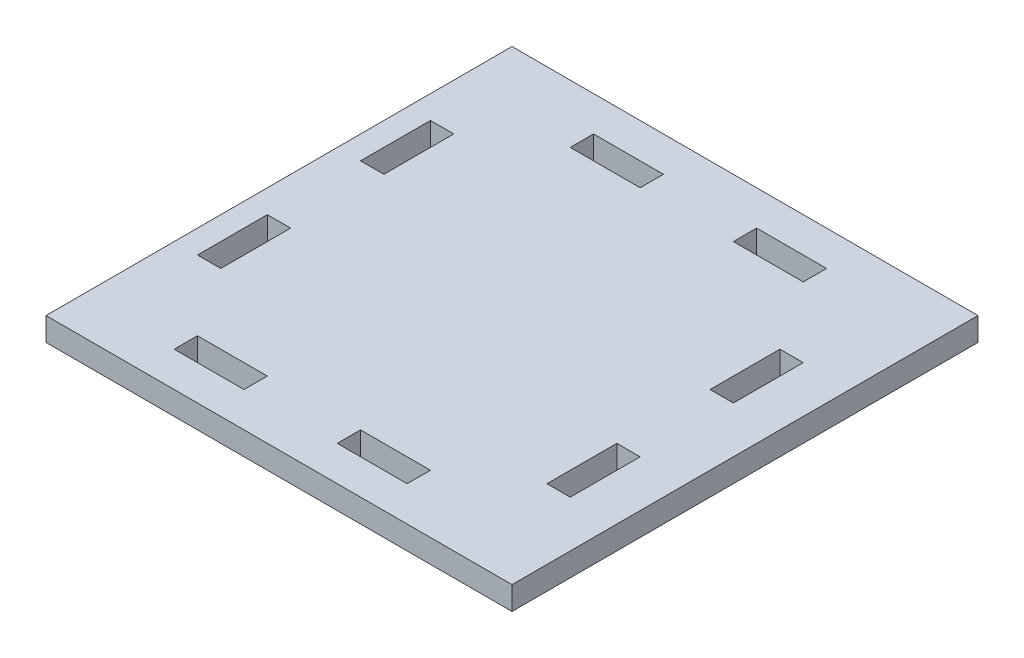
from build123d import *

# Parameters (mm, degrees)
SKETCH1_W   = 127
SKETCH1_H   = 127
SKETCH1_W_2 = 19.05
SKETCH1_H_2 = 6.35
SKETCH1_W_3 = 6.35
SKETCH1_H_3 = 19.05
BASE_DEPTH  = 6.35


with BuildPart() as part:
    # Sketch1 → BASE (new body)
    with BuildSketch(Plane(origin=(0, 0, 0), x_dir=(1, 0, 0), z_dir=(0, 1, 0))):
        Rectangle(SKETCH1_W, SKETCH1_H)
        with Locations((-28.575, -50.8)):
            Rectangle(SKETCH1_W_2, SKETCH1_H_2, mode=Mode.SUBTRACT)
        with Locations((-53.975, -19.05)):
            Rectangle(SKETCH1_W_3, SKETCH1_H_3, mode=Mode.SUBTRACT)
        with Locations((15.875, -50.8)):
            Rectangle(SKETCH1_W_2, SKETCH1_H_2, mode=Mode.SUBTRACT)
        with Locations((47.625, -25.4)):
            Rectangle(SKETCH1_W_3, SKETCH1_H_3, mode=Mode.SUBTRACT)
        with Locations((-53.975, 25.4)):
            Rectangle(SKETCH1_W_3, SKETCH1_H_3, mode=Mode.SUBTRACT)
        with Locations((-22.225, 50.8)):
            Rectangle(SKETCH1_W_2, SKETCH1_H_2, mode=Mode.SUBTRACT)
        with Locations((47.625, 19.05)):
            Rectangle(SKETCH1_W_3, SKETCH1_H_3, mode=Mode.SUBTRACT)
        with Locations((22.225, 50.8)):
            Rectangle(SKETCH1_W_2, SKETCH1_H_2, mode=Mode.SUBTRACT)
    extrude(amount=BASE_DEPTH)


solid = part.part
